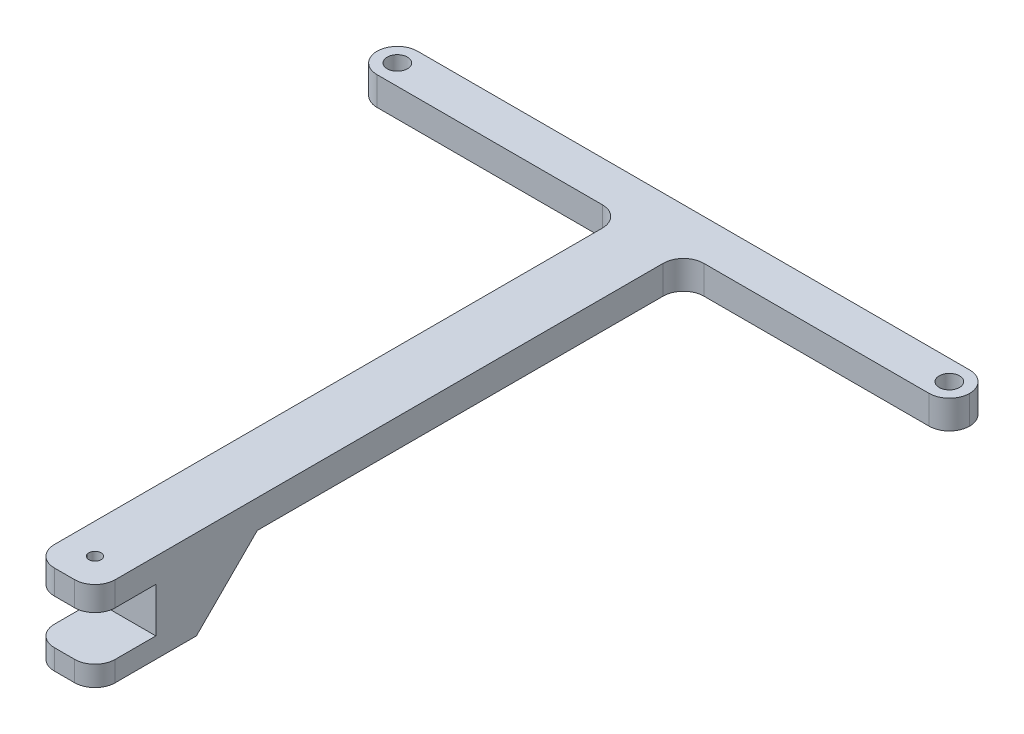
from build123d import *

# Parameters (mm, degrees)
SALIENTE_EXTRUIR1_DEPTH = 7.5
CROQUIS4_R              = 1.5
CORTAR_EXTRUIR2_DEPTH   = 6
CROQUIS5_W              = 146
CROQUIS5_H              = 10
CROQUIS5_R              = 2.5
SALIENTE_EXTRUIR2_DEPTH = 7
REDONDEO2_R             = 5


with BuildPart() as part:
    # Croquis1 → Saliente-Extruir1 (new, symmetric)
    with BuildSketch(Plane(origin=(0, 0, 0), x_dir=(0, 0, -1), z_dir=(1, 0, 0))):
        Polygon((0, 0), (0, 11), (-15, 11), (-15, 17), (140, 17), (140, 10), (25, 10), (10, -5), (-15, -5), (-15, 0), align=None)
    extrude(amount=SALIENTE_EXTRUIR1_DEPTH, both=True)

    # Croquis4 → Cortar-Extruir2 (cut)
    with BuildSketch(Plane(origin=(0, 17, 0), x_dir=(1, 0, 0), z_dir=(0, 1, 0))):
        with Locations(Location((0, -7.5, 0), (0, 0, 270))):
            Circle(CROQUIS4_R)
    extrude(amount=-CORTAR_EXTRUIR2_DEPTH, mode=Mode.SUBTRACT)

    # Croquis5 → Saliente-Extruir2 (add)
    with BuildSketch(Plane(origin=(0, 17, 0), x_dir=(1, 0, 0), z_dir=(0, 1, 0))):
        with Locations((0, 135)):
            Rectangle(CROQUIS5_W, CROQUIS5_H)
        with Locations(Location((-68, 135, 0), (0, 0, 270))):
            Circle(CROQUIS5_R, mode=Mode.SUBTRACT)
        with Locations(Location((68, 135, 0), (0, 0, 270))):
            Circle(CROQUIS5_R, mode=Mode.SUBTRACT)
    extrude(amount=-SALIENTE_EXTRUIR2_DEPTH)

    # Redondeo2
    redondeo2_edges = [part.edges().sort_by_distance(p)[0] for p in [
        (-7.5, 13.5, -130),
        (-73, 13.5, -140),
        (-73, 13.5, -130),
        (7.5, 13.5, -130),
        (7.5, -2.5, 15),
        (-7.5, -2.5, 15),
        (-7.5, 14, 15),
        (7.5, 14, 15),
        (73, 13.5, -140),
        (73, 13.5, -130),
    ]]
    fillet(redondeo2_edges, radius=REDONDEO2_R - 0.0001)  # a hair under: the kernel refuses the full size


solid = part.part
